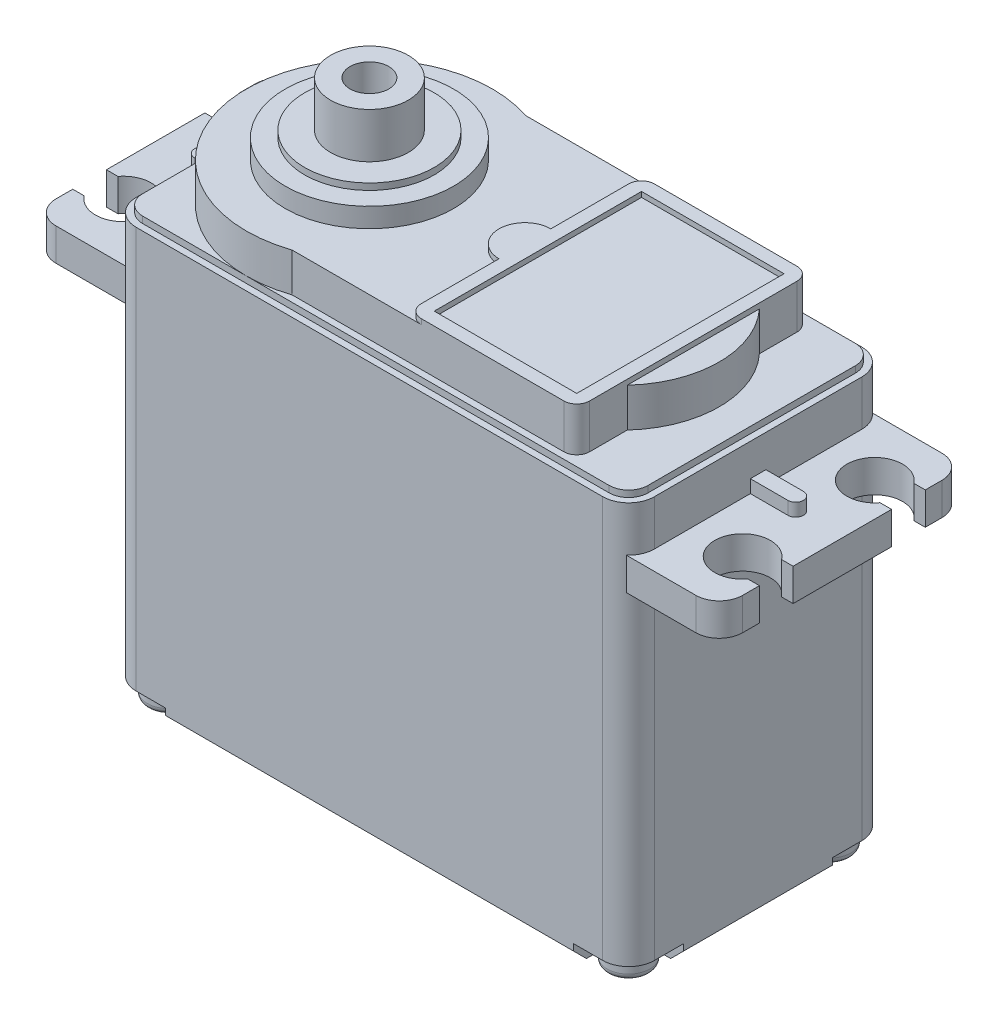
from build123d import *

# Parameters (mm, degrees)
EXTRUDE_1_DEPTH     = 32.5
EXTRUDE_2_DEPTH     = 0.5
CUT_EXTRUDE_1_DEPTH = 1.5
CHAMFER_1_SIZE      = 1
EXTRUDE_3_DEPTH     = 3
SKETCH_5_W          = 11
SKETCH_5_H          = 16
EXTRUDE_4_DEPTH     = 0.4
SKETCH_6_R          = 6.5
EXTRUDE_5_DEPTH     = 1.5
SKETCH_7_R          = 5
EXTRUDE_6_DEPTH     = 0.5
SKETCH_8_R          = 3
SKETCH_8_R_2        = 1.5
EXTRUDE_7_DEPTH     = 3.5
EXTRUDE_8_DEPTH     = 3
EXTRUDE_9_DEPTH     = 2.5
EXTRUDE_10_DEPTH    = 1
SKETCH_12_R         = 1.65
EXTRUDE_11_DEPTH    = 1.5
FILLET_1_R          = 0.5


with BuildPart() as part:
    # Эскиз1 → Бобышка-Вытянуть1 (new body)
    with BuildSketch(Plane(origin=(0, 0, 0), x_dir=(1, 0, 0), z_dir=(0, 1, 0))):
        with BuildLine():
            Line((-18, -10), (18, -10))
            ThreePointArc((18, -10), (19.414213562, -9.414213562), (20, -8))
            Line((20, -8), (20, 8))
            ThreePointArc((20, 8), (19.414213562, 9.414213562), (18, 10))
            Line((18, 10), (-18, 10))
            ThreePointArc((-18, 10), (-19.414213562, 9.414213562), (-20, 8))
            Line((-20, 8), (-20, -8))
            ThreePointArc((-20, -8), (-19.414213562, -9.414213562), (-18, -10))
        make_face()
    extrude(amount=EXTRUDE_1_DEPTH)

    # Эскиз2 → Бобышка-Вытянуть2 (add)
    with BuildSketch(Plane(origin=(0, 32.5, 0), x_dir=(1, 0, 0), z_dir=(0, 1, 0))):
        with BuildLine():
            Line((-18, -9.5), (18, -9.5))
            ThreePointArc((18, -9.5), (19.060660172, -9.060660172), (19.5, -8))
            Line((19.5, -8), (19.5, 8))
            ThreePointArc((19.5, 8), (19.060660172, 9.060660172), (18, 9.5))
            Line((18, 9.5), (-18, 9.5))
            ThreePointArc((-18, 9.5), (-19.060660172, 9.060660172), (-19.5, 8))
            Line((-19.5, 8), (-19.5, -8))
            ThreePointArc((-19.5, -8), (-19.060660172, -9.060660172), (-18, -9.5))
        make_face()
    extrude(amount=EXTRUDE_2_DEPTH)

    # Эскиз3 → Вырез-Вытянуть1 (cut)
    with BuildSketch(Plane.XZ):
        with BuildLine():
            Line((-21.918547291, 5.75), (-17.75, 5.75))
            ThreePointArc((-17.75, 5.75), (-16.335786438, 6.335786438), (-15.75, 7.75))
            Line((-15.75, 7.75), (-15.75, 12.092571755))
            Line((-15.75, 12.092571755), (-21.918547291, 12.092571755))
            Line((-21.918547291, 12.092571755), (-21.918547291, 5.75))
        make_face()
        with BuildLine():
            Line((15.75, 12.092571755), (21.918547291, 12.092571755))
            Line((21.918547291, 12.092571755), (21.918547291, 5.75))
            Line((21.918547291, 5.75), (17.75, 5.75))
            ThreePointArc((17.75, 5.75), (16.335786438, 6.335786438), (15.75, 7.75))
            Line((15.75, 7.75), (15.75, 12.092571755))
        make_face()
        with BuildLine():
            Line((21.918547291, -5.75), (17.75, -5.75))
            ThreePointArc((17.75, -5.75), (16.335786438, -6.335786438), (15.75, -7.75))
            Line((15.75, -7.75), (15.75, -12.092571755))
            Line((15.75, -12.092571755), (21.918547291, -12.092571755))
            Line((21.918547291, -12.092571755), (21.918547291, -5.75))
        make_face()
        with BuildLine():
            Line((-15.75, -12.092571755), (-21.918547291, -12.092571755))
            Line((-21.918547291, -12.092571755), (-21.918547291, -5.75))
            Line((-21.918547291, -5.75), (-17.75, -5.75))
            ThreePointArc((-17.75, -5.75), (-16.335786438, -6.335786438), (-15.75, -7.75))
            Line((-15.75, -7.75), (-15.75, -12.092571755))
        make_face()
    extrude(amount=-CUT_EXTRUDE_1_DEPTH, mode=Mode.SUBTRACT)

    # Фаска1
    chamfer_1_edges = [part.edges().sort_by_distance(p)[0] for p in [
        (-20, 0, 0),
        (0, 0, 10),
        (20, 0, 0),
        (0, 0, -10),
    ]]
    chamfer(chamfer_1_edges, length=CHAMFER_1_SIZE)

    # Эскиз4 → Бобышка-Вытянуть3 (add)
    with BuildSketch(Plane(origin=(0, 33, 0), x_dir=(1, 0, 0), z_dir=(0, 1, 0))):
        with BuildLine():
            Line((15, 8), (15, -8))
            ThreePointArc((15, -8), (14.707106781, -8.707106781), (14, -9))
            Line((14, -9), (-6.958618735, -9))
            ThreePointArc((-6.958618735, -9), (-19.5, 0), (-6.958618735, 9))
            Line((-6.958618735, 9), (14, 9))
            ThreePointArc((14, 9), (14.707106781, 8.707106781), (15, 8))
        make_face()
    extrude(amount=EXTRUDE_3_DEPTH)

    # Эскиз5 → Бобышка-Вытянуть4 (add)
    # profile 1 of 2: a face of its own
    with BuildSketch(Plane(origin=(0, 36, 0), x_dir=(1, 0, 0), z_dir=(0, 1, 0))):
        with BuildLine():
            ThreePointArc((2, 2), (0, 0), (2, -2))
            Line((2, -2), (2, 2))
        make_face()
    # profile 2 of 2: a face of its own
    with BuildSketch(Plane(origin=(0, 36, 0), x_dir=(1, 0, 0), z_dir=(0, 1, 0))):
        with BuildLine():
            ThreePointArc((14, -9), (14.707106781, -8.707106781), (15, -8))
            Line((15, -8), (15, 8))
            ThreePointArc((15, 8), (14.707106781, 8.707106781), (14, 9))
            Line((14, 9), (3, 9))
            ThreePointArc((3, 9), (2.292893219, 8.707106781), (2, 8))
            Line((2, 8), (2, 2))
            Line((2, 2), (2, -2))
            Line((2, -2), (2, -8))
            ThreePointArc((2, -8), (2.292893219, -8.707106781), (3, -9))
            Line((3, -9), (14, -9))
        make_face()
        with Locations((8.5, 0)):
            Rectangle(SKETCH_5_W, SKETCH_5_H, mode=Mode.SUBTRACT)
    extrude(amount=EXTRUDE_4_DEPTH)

    # Эскиз6 → Бобышка-Вытянуть5 (add)
    with BuildSketch(Plane(origin=(0, 36, 0), x_dir=(1, 0, 0), z_dir=(0, 1, 0))):
        with Locations(Location((-10, 0, 0), (0, 0, 270))):
            Circle(SKETCH_6_R)
    extrude(amount=EXTRUDE_5_DEPTH)

    # Эскиз7 → Бобышка-Вытянуть6 (add)
    with BuildSketch(Plane(origin=(0, 37.5, 0), x_dir=(1, 0, 0), z_dir=(0, 1, 0))):
        with Locations(Location((-10, 0, 0), (0, 0, 270))):
            Circle(SKETCH_7_R)
    extrude(amount=EXTRUDE_6_DEPTH)

    # Эскиз8 → Бобышка-Вытянуть7 (add)
    with BuildSketch(Plane(origin=(0, 38, 0), x_dir=(1, 0, 0), z_dir=(0, 1, 0))):
        with Locations(Location((-10, 0, 0), (0, 0, 270))):
            Circle(SKETCH_8_R)
        with Locations(Location((-10, 0, 0), (0, 0, 270))):
            Circle(SKETCH_8_R_2, mode=Mode.SUBTRACT)
    extrude(amount=EXTRUDE_7_DEPTH)

    # Эскиз9 → Бобышка-Вытянуть8 (add)
    with BuildSketch(Plane(origin=(0, 33, 0), x_dir=(1, 0, 0), z_dir=(0, 1, 0))):
        with BuildLine():
            Line((14.5, 5.590169944), (14.5, -5.590169944))
            ThreePointArc((14.5, -5.590169944), (17, 0), (14.5, 5.590169944))
        make_face()
    extrude(amount=EXTRUDE_8_DEPTH)

    # Эскиз10 → Бобышка-Вытянуть9 (add)
    with BuildSketch(Plane(origin=(0, 26.5, 0), x_dir=(-1, 0, 0), z_dir=(0, -1, 0))):
        with BuildLine():
            Line((-26.5, 6.4), (-25.612454379, 6.4))
            ThreePointArc((-25.612454379, 6.4), (-21.75, 5.1), (-25.612454379, 3.8))
            Line((-25.612454379, 3.8), (-26.5, 3.8))
            Line((-26.5, 3.8), (-26.5, -3.8))
            Line((-26.5, -3.8), (-25.612454379, -3.8))
            ThreePointArc((-25.612454379, -3.8), (-21.75, -5.1), (-25.612454379, -6.4))
            Line((-25.612454379, -6.4), (-26.5, -6.4))
            Line((-26.5, -6.4), (-26.5, -7.688401811))
            ThreePointArc((-26.5, -7.688401811), (-25.969395175, -8.969395175), (-24.688401811, -9.5))
            Line((-24.688401811, -9.5), (24.688401811, -9.5))
            ThreePointArc((24.688401811, -9.5), (25.969395175, -8.969395175), (26.5, -7.688401811))
            Line((26.5, -7.688401811), (26.5, -6.4))
            Line((26.5, -6.4), (25.612454379, -6.4))
            ThreePointArc((25.612454379, -6.4), (21.75, -5.1), (25.612454379, -3.8))
            Line((25.612454379, -3.8), (26.5, -3.8))
            Line((26.5, -3.8), (26.5, 3.8))
            Line((26.5, 3.8), (25.612454379, 3.8))
            ThreePointArc((25.612454379, 3.8), (21.75, 5.1), (25.612454379, 6.4))
            Line((25.612454379, 6.4), (26.5, 6.4))
            Line((26.5, 6.4), (26.5, 7.688401811))
            ThreePointArc((26.5, 7.688401811), (25.969395175, 8.969395175), (24.688401811, 9.5))
            Line((24.688401811, 9.5), (-24.688401811, 9.5))
            ThreePointArc((-24.688401811, 9.5), (-25.969395175, 8.969395175), (-26.5, 7.688401811))
            Line((-26.5, 7.688401811), (-26.5, 6.4))
        make_face()
    extrude(amount=-EXTRUDE_9_DEPTH)

    # Эскиз11 → Бобышка-Вытянуть10 (add)
    with BuildSketch(Plane(origin=(0, 29, 0), x_dir=(1, 0, 0), z_dir=(0, 1, 0))):
        with BuildLine():
            Line((22.9, 0.6), (18.027551533, 0.6))
            Line((18.027551533, 0.6), (18.027551533, -0.6))
            Line((18.027551533, -0.6), (22.9, -0.6))
            ThreePointArc((22.9, -0.6), (23.5, 0), (22.9, 0.6))
        make_face()
        with BuildLine():
            Line((-22.9, 0.6), (-18.027551533, 0.6))
            Line((-18.027551533, 0.6), (-18.027551533, -0.6))
            Line((-18.027551533, -0.6), (-22.9, -0.6))
            ThreePointArc((-22.9, -0.6), (-23.5, 0), (-22.9, 0.6))
        make_face()
    extrude(amount=EXTRUDE_10_DEPTH)

    # Эскиз12 → Бобышка-Вытянуть11 (add)
    # profile 1 of 4: a face of its own
    with BuildSketch(Plane.XZ.offset(-1.5)):
        with Locations(Location((-17.75, 7.75, 0), (0, 0, 90))):
            Circle(SKETCH_12_R)
        Polygon((-18, 8), (-19, 8), (-19, 7.5), (-18, 7.5), (-18, 6.5), (-17.5, 6.5), (-17.5, 7.5), (-16.5, 7.5), (-16.5, 8), (-17.5, 8), (-17.5, 9), (-18, 9), align=None, mode=Mode.SUBTRACT)
    # profile 2 of 4: a face of its own
    with BuildSketch(Plane.XZ.offset(-1.5)):
        with Locations(Location((17.75, 7.75, 0), (0, 0, 90))):
            Circle(SKETCH_12_R)
        Polygon((16.5, 7.5), (16.5, 8), (17.5, 8), (17.5, 9), (18, 9), (18, 8), (19, 8), (19, 7.5), (18, 7.5), (18, 6.5), (17.5, 6.5), (17.5, 7.5), align=None, mode=Mode.SUBTRACT)
    # profile 3 of 4: a face of its own
    with BuildSketch(Plane.XZ.offset(-1.5)):
        with Locations(Location((17.75, -7.75, 0), (0, 0, 90))):
            Circle(SKETCH_12_R)
        Polygon((16.5, -8), (17.5, -8), (17.5, -9), (18, -9), (18, -8), (19, -8), (19, -7.5), (18, -7.5), (18, -6.5), (17.5, -6.5), (17.5, -7.5), (16.5, -7.5), align=None, mode=Mode.SUBTRACT)
    # profile 4 of 4: a face of its own
    with BuildSketch(Plane.XZ.offset(-1.5)):
        with Locations(Location((-17.75, -7.75, 0), (0, 0, 90))):
            Circle(SKETCH_12_R)
        Polygon((-17.5, -6.5), (-17.5, -7.5), (-16.5, -7.5), (-16.5, -8), (-17.5, -8), (-17.5, -9), (-18, -9), (-18, -8), (-19, -8), (-19, -7.5), (-18, -7.5), (-18, -6.5), align=None, mode=Mode.SUBTRACT)
    extrude(amount=EXTRUDE_11_DEPTH)

    # Скругление1
    # the kernel refuses this fillet: 0.5 mm, written as the material it takes off along each edge
    with BuildSketch(Plane(origin=(17.75, 0, 7.75), x_dir=(0, 0, 1), z_dir=(1, 0, 0))) as fillet_1_piece_1:
        with BuildLine():
            CenterArc((1.65 - FILLET_1_R, -FILLET_1_R), FILLET_1_R, 0, 90)
            Line((1.65 - FILLET_1_R, 0), (1.65, 0))
            Line((1.65, 0), (1.65, -FILLET_1_R))
        make_face()
    revolve(axis=Axis((17.75, 0, 7.75), (0, -1, 0)), mode=Mode.SUBTRACT)
    with BuildSketch(Plane(origin=(17.75, 0, -7.75), x_dir=(0, 0, 1), z_dir=(1, 0, 0))) as fillet_1_piece_2:
        with BuildLine():
            CenterArc((1.65 - FILLET_1_R, -FILLET_1_R), FILLET_1_R, 0, 90)
            Line((1.65 - FILLET_1_R, 0), (1.65, 0))
            Line((1.65, 0), (1.65, -FILLET_1_R))
        make_face()
    revolve(axis=Axis((17.75, 0, -7.75), (0, -1, 0)), mode=Mode.SUBTRACT)
    with BuildSketch(Plane(origin=(-17.75, 0, -7.75), x_dir=(0, 0, 1), z_dir=(1, 0, 0))) as fillet_1_piece_3:
        with BuildLine():
            CenterArc((1.65 - FILLET_1_R, -FILLET_1_R), FILLET_1_R, 0, 90)
            Line((1.65 - FILLET_1_R, 0), (1.65, 0))
            Line((1.65, 0), (1.65, -FILLET_1_R))
        make_face()
    revolve(axis=Axis((-17.75, 0, -7.75), (0, -1, 0)), mode=Mode.SUBTRACT)
    with BuildSketch(Plane(origin=(-17.75, 0, 7.75), x_dir=(0, 0, 1), z_dir=(1, 0, 0))) as fillet_1_piece_4:
        with BuildLine():
            CenterArc((1.65 - FILLET_1_R, -FILLET_1_R), FILLET_1_R, 0, 90)
            Line((1.65 - FILLET_1_R, 0), (1.65, 0))
            Line((1.65, 0), (1.65, -FILLET_1_R))
        make_face()
    revolve(axis=Axis((-17.75, 0, 7.75), (0, -1, 0)), mode=Mode.SUBTRACT)


solid = part.part
